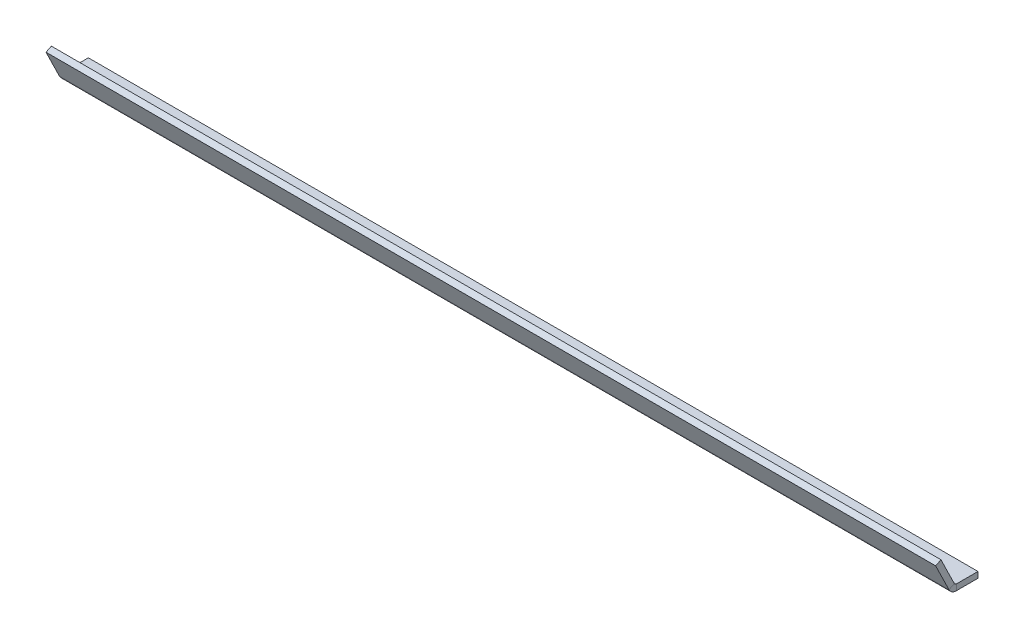
from build123d import *

# Parameters (mm, degrees)
SKETCH2_W            = 1200
SKETCH2_H            = 40
BASE_FLANGE1_DEPTH   = 8
EDGE_FLANGE1_START   = -600
EDGE_FLANGE1_DEPTH   = 1200
EDGE_FLANGE1_2_DEPTH = 1200


# Read off the part's stored shape, not the designer's step: Edge-Flange1
# Sheet-metal steps are written as plain solids
with BuildPart() as part:
    # Sketch2 → Base-Flange1 (new body)
    with BuildSketch(Plane(origin=(0, 0, 0), x_dir=(1, 0, 0), z_dir=(0, 1, 0))):
        with Locations((0, 20)):
            Rectangle(SKETCH2_W, SKETCH2_H)
    extrude(amount=-BASE_FLANGE1_DEPTH)

    # Edge-Flange1 outline → Edge-Flange1 (cut)
    with BuildSketch(Plane.YZ.offset(EDGE_FLANGE1_START)):
        with BuildLine():
            ThreePointArc((-8, -10.77542358), (-6.328529058, -4.946311673), (-1.822082615, -0.88868907))
            Line((-1.822082615, -0.88868907), (0, 0))
            Line((0, 0), (-8, 0))
            Line((-8, 0), (-8, -10.77542358))
        make_face()
    extrude(amount=EDGE_FLANGE1_DEPTH, mode=Mode.SUBTRACT)

    # Edge-Flange1 2 outline → Edge-Flange1 2 (add)
    with BuildSketch(Plane.YZ.offset(EDGE_FLANGE1_START)):
        with BuildLine():
            Line((35.142114222, 17.139954337), (0, 0))
            Line((0, 0), (0, -10.77542358))
            ThreePointArc((0, -10.77542358), (0.455855712, -9.185665787), (1.68488656, -8.079041441))
            Line((1.68488656, -8.079041441), (38.649083397, 9.949601967))
            Line((38.649083397, 9.949601967), (35.142114222, 17.139954337))
        make_face()
    extrude(amount=EDGE_FLANGE1_2_DEPTH)


solid = part.part
